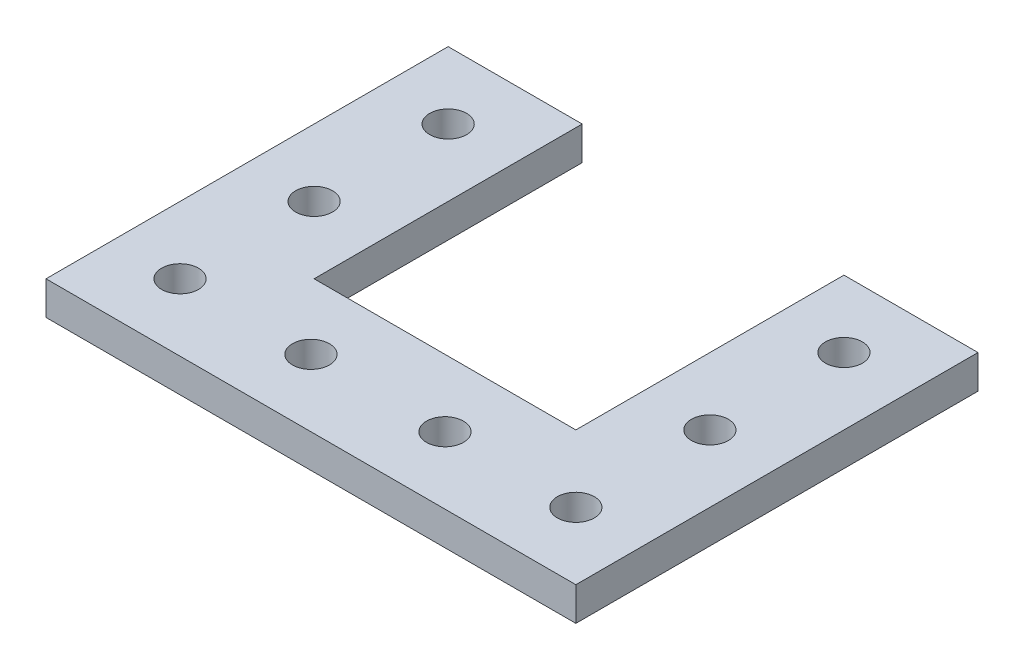
from build123d import *

# Parameters (mm, degrees)
BOSS_EXTRUDE1_DEPTH = 6.35
SKETCH2_R           = 3.5
CUT_EXTRUDE1_DEPTH  = 6.35


with BuildPart() as part:
    # Sketch1 → Boss-Extrude1 (new body)
    with BuildSketch(Plane(origin=(0, 0, 0), x_dir=(1, 0, 0), z_dir=(0, 1, 0))):
        Polygon((100.4, 0), (100.4, 76.2), (75, 76.2), (75, 25.4), (25.4, 25.4), (25.4, 76.2), (0, 76.2), (0, 0), align=None)
    extrude(amount=BOSS_EXTRUDE1_DEPTH)

    # Sketch2 → Cut-Extrude1 (cut)
    with BuildSketch(Plane(origin=(0, 6.35, 0), x_dir=(1, 0, 0), z_dir=(0, 1, 0))):
        with Locations((12.7, 12.7)):
            Circle(SKETCH2_R)
        with Locations((12.7, 38.1)):
            Circle(SKETCH2_R)
        with Locations((12.7, 63.5)):
            Circle(SKETCH2_R)
        with Locations((87.7, 63.5)):
            Circle(SKETCH2_R)
        with Locations((87.7, 38.1)):
            Circle(SKETCH2_R)
        with Locations((87.7, 12.7)):
            Circle(SKETCH2_R)
        with Locations((37.5, 12.7)):
            Circle(SKETCH2_R)
        with Locations((62.9, 12.7)):
            Circle(SKETCH2_R)
    extrude(amount=-CUT_EXTRUDE1_DEPTH, mode=Mode.SUBTRACT)


solid = part.part
